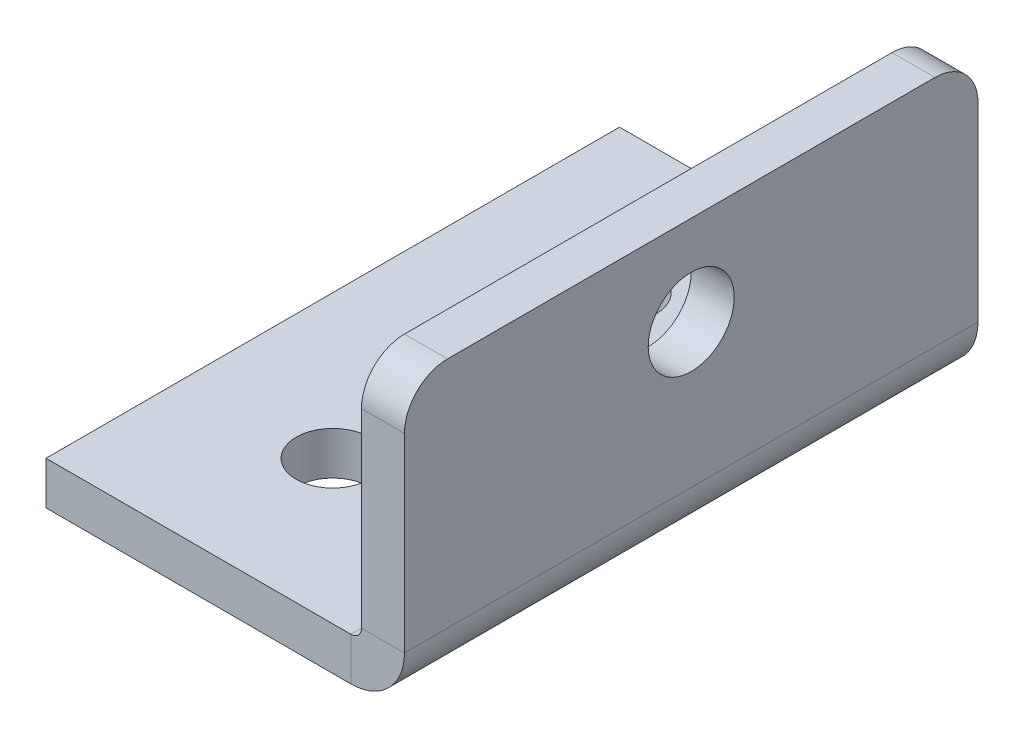
from build123d import *

# Parameters (mm, degrees)
BASE_FLANGE1_DEPTH = 40
CUT_EXTRUDE1_REACH = 52.14
SKETCH6_R          = 2.55
CUT_EXTRUDE2_REACH = 51.84
SKETCH7_R          = 3
FILLET1_R          = 3


# Sheet-metal steps are written as plain solids
with BuildPart() as part:
    # Sketch1 → Base-Flange1 (new body)
    with BuildSketch(Plane.XY):
        with BuildLine():
            Line((0, 20), (0, 3.7366))
            ThreePointArc((0, 3.7366), (-1.094424801, 1.094424801), (-3.7366, 0))
            Line((-3.7366, 0), (-25, 0))
            Line((-25, 0), (-25, 3))
            Line((-25, 3), (-3.7366, 3))
            ThreePointArc((-3.7366, 3), (-3.215745145, 3.215745145), (-3, 3.7366))
            Line((-3, 3.7366), (-3, 20))
            Line((-3, 20), (0, 20))
        make_face()
    extrude(amount=BASE_FLANGE1_DEPTH)

    # Sketch6 → Cut-Extrude1 (cut, up to next)
    with BuildSketch(Plane(origin=(0, 3, 0), x_dir=(1, 0, 0), z_dir=(0, 1, 0)), mode=Mode.PRIVATE) as cut_extrude1_sk1:
        with Locations(Location((-15, -10, 0), (0, 0, 180))):
            Circle(SKETCH6_R)
    cut_extrude1_tool1 = extrude(cut_extrude1_sk1.sketch, amount=-CUT_EXTRUDE1_REACH, mode=Mode.PRIVATE) & part.part
    # Sketch6 → Cut-Extrude1 (cut, up to next)
    with BuildSketch(Plane(origin=(0, 3, 0), x_dir=(1, 0, 0), z_dir=(0, 1, 0)), mode=Mode.PRIVATE) as cut_extrude1_sk2:
        with Locations(Location((-15, -30, 0), (0, 0, 180))):
            Circle(SKETCH6_R)
    cut_extrude1_tool2 = extrude(cut_extrude1_sk2.sketch, amount=-CUT_EXTRUDE1_REACH, mode=Mode.PRIVATE) & part.part
    add(cut_extrude1_tool1.solids().sort_by_distance((-15, 3, 10))[0], mode=Mode.SUBTRACT)
    add(cut_extrude1_tool2.solids().sort_by_distance((-15, 3, 30))[0], mode=Mode.SUBTRACT)

    # Sketch7 → Cut-Extrude2 (cut, up to next)
    with BuildSketch(Plane.ZY.offset(3), mode=Mode.PRIVATE) as cut_extrude2_sk1:
        with Locations((20, 13.7366)):
            Circle(SKETCH7_R)
    cut_extrude2_tool1 = extrude(cut_extrude2_sk1.sketch, amount=-CUT_EXTRUDE2_REACH, mode=Mode.PRIVATE) & part.part
    add(cut_extrude2_tool1.solids().sort_by_distance((-3, 13.7366, 20))[0], mode=Mode.SUBTRACT)

    # Fillet1
    fillet1_edges = [part.edges().sort_by_distance(p)[0] for p in [
        (-1.5, 20, 40),
        (-1.5, 20, 0),
    ]]
    fillet(fillet1_edges, radius=FILLET1_R)


solid = part.part
